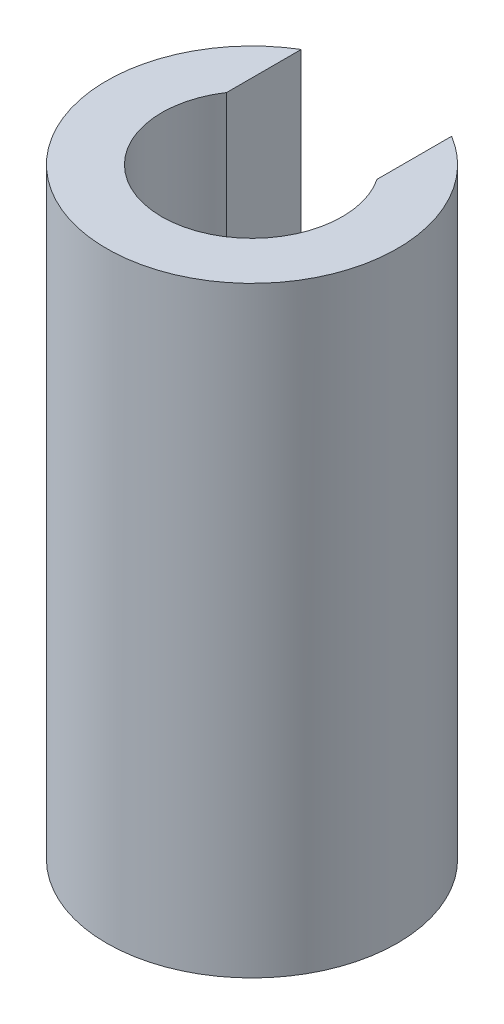
from build123d import *

# Parameters (mm, degrees)
SKETCH1_R           = 2.9
BOSS_EXTRUDE1_DEPTH = 12
SKETCH3_R           = 1.8
CUT_EXTRUDE1_DEPTH  = 12
SKETCH4_W           = 3
SKETCH4_H           = 2.9
CUT_EXTRUDE2_DEPTH  = 6


with BuildPart() as part:
    # Sketch1 → Boss-Extrude1 (new body)
    with BuildSketch(Plane(origin=(0, 0, 0), x_dir=(1, 0, 0), z_dir=(0, 1, 0))):
        Circle(SKETCH1_R)
    extrude(amount=BOSS_EXTRUDE1_DEPTH)

    # Sketch3 → Cut-Extrude1 (cut)
    with BuildSketch(Plane.XZ):
        Circle(SKETCH3_R)
    extrude(amount=-CUT_EXTRUDE1_DEPTH, mode=Mode.SUBTRACT)

    # Sketch4 → Cut-Extrude2 (cut)
    with BuildSketch(Plane(origin=(0, 12, 0), x_dir=(1, 0, 0), z_dir=(0, 1, 0))):
        with Locations((0, 1.45)):
            Rectangle(SKETCH4_W, SKETCH4_H)
    extrude(amount=-CUT_EXTRUDE2_DEPTH, mode=Mode.SUBTRACT)


solid = part.part
